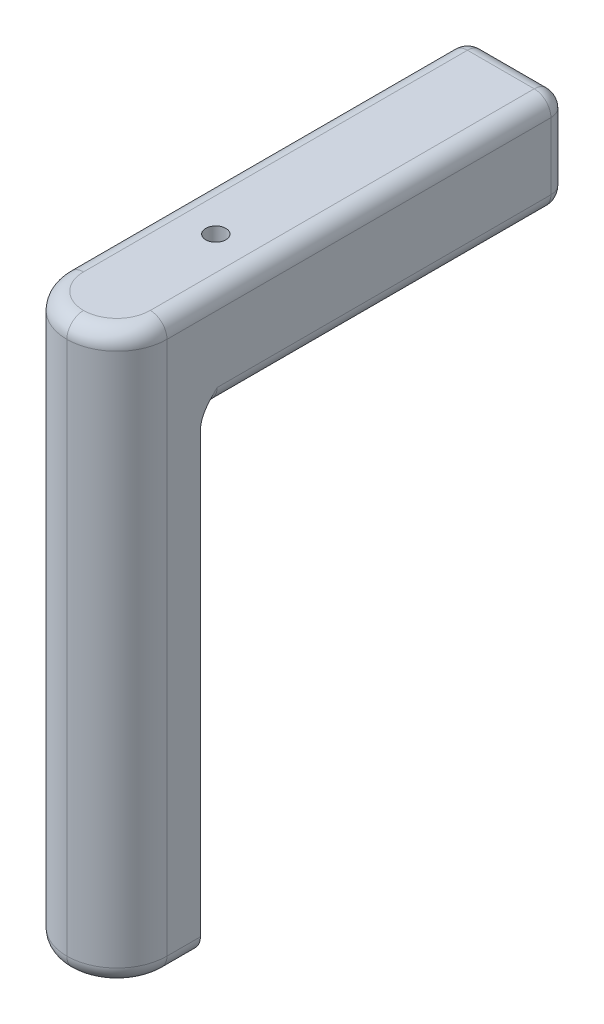
from build123d import *

# Parameters (mm, degrees)
SKETCH1_W           = 60
SKETCH1_H           = 60
BOSS_EXTRUDE1_DEPTH = 270
SKETCH2_W           = 60
SKETCH2_H           = 50
BOSS_EXTRUDE2_DEPTH = 280
SKETCH3_R           = 15
CUT_EXTRUDE1_DEPTH  = 50
SKETCH4_R           = 27.5
CUT_EXTRUDE2_DEPTH  = 25
FILLET1_R           = 30
FILLET2_R           = 30
FILLET3_R           = 10
FILLET4_R           = 10
FILLET5_R           = 10
FILLET6_R           = 10
FILLET7_R           = 10
SKETCH5_R           = 6
CUT_EXTRUDE4_DEPTH  = 394.573373167


# Some blends are built 0.0001 mm under size
with BuildPart() as part:
    # Sketch1 → Boss-Extrude1 (new body)
    with BuildSketch(Plane.XY):
        with Locations((30, -30)):
            Rectangle(SKETCH1_W, SKETCH1_H)
    extrude(amount=BOSS_EXTRUDE1_DEPTH)

    # Sketch2 → Boss-Extrude2 (add)
    with BuildSketch(Plane.XZ.offset(60)):
        with Locations((30, 245)):
            Rectangle(SKETCH2_W, SKETCH2_H)
    extrude(amount=BOSS_EXTRUDE2_DEPTH)

    # Sketch3 → Cut-Extrude1 (cut)
    with BuildSketch(Plane(origin=(0, 0, 0), x_dir=(-1, 0, 0), z_dir=(0, 0, -1))):
        with Locations((-30, -30)):
            Circle(SKETCH3_R)
    extrude(amount=-CUT_EXTRUDE1_DEPTH, mode=Mode.SUBTRACT)

    # Sketch4 → Cut-Extrude2 (cut)
    with BuildSketch(Plane(origin=(0, 0, 220), x_dir=(-1, 0, 0), z_dir=(0, 0, -1))):
        with Locations((-30, -300)):
            Circle(SKETCH4_R)
    extrude(amount=-CUT_EXTRUDE2_DEPTH, mode=Mode.SUBTRACT)

    # Fillet1
    fillet1_edges = [part.edges().sort_by_distance(p)[0] for p in [
        (60, -170, 270),
    ]]
    fillet(fillet1_edges, radius=FILLET1_R)

    # Fillet2
    fillet2_edges = [part.edges().sort_by_distance(p)[0] for p in [
        (0, -170, 270),
    ]]
    fillet(fillet2_edges, radius=FILLET2_R - 0.0001)  # a hair under: the kernel refuses the full size

    # Fillet3
    fillet3_edges = [part.edges().sort_by_distance(p)[0] for p in [
        (60, 0, 120),
        (51.213203436, 0, 261.213203436),
        (0, 0, 120.00005),
        (8.786767275, 0, 261.213232725),
    ]]
    fillet(fillet3_edges, radius=FILLET3_R)

    # Fillet4
    fillet4_edges = [part.edges().sort_by_distance(p)[0] for p in [
        (60, -35, 0),
        (30, 0, 0),
        (0, -35, 0),
        (2.928932188, -2.928932188, 0),
        (57.071067812, -2.928932188, 0),
    ]]
    fillet(fillet4_edges, radius=FILLET4_R)

    # Fillet5
    fillet5_edges = [part.edges().sort_by_distance(p)[0] for p in [
        (60, -60, 115),
        (0, -60, 115),
        (30, -60, 0),
        (2.928932188, -60, 2.928932188),
        (57.071067812, -60, 2.928932188),
    ]]
    fillet(fillet5_edges, radius=FILLET5_R)

    # Fillet6
    # the kernel refuses this fillet: 10 mm, written as the material it adds along each edge
    with BuildSketch(Plane(origin=(50, -60, 220), x_dir=(0, 0, -1), z_dir=(-1, 0, 0))) as fillet6_piece_1:
        with BuildLine():
            CenterArc((FILLET6_R, FILLET6_R), FILLET6_R, 180, 90)
            Line((0, FILLET6_R), (0, 0))
            Line((0, 0), (FILLET6_R, 0))
        make_face()
    extrude(amount=40)
    with BuildSketch(Plane(origin=(50, -50, 220), x_dir=(-0.8017442392976486, 0.5976672776328272, 0), z_dir=(-0.5976672776328272, -0.8017442392976486, 0))) as fillet6_piece_2_section:
        with BuildLine():
            CenterArc((10 + FILLET6_R, FILLET6_R), FILLET6_R, 180, 90)
            Line((10 + FILLET6_R, 0), (10, 0))
            Line((10, 0), (10, FILLET6_R))
        make_face()
    fillet6_piece_2 = revolve(axis=Axis((50, -50, 220), (0, 0, -1)), revolution_arc=233.296989237, mode=Mode.PRIVATE)
    fillet6_piece_2 = split(fillet6_piece_2, bisect_by=Plane(origin=(60, -57.499389328, 216.883716878), z_dir=(-1, 0, 0)), keep=Keep.TOP, mode=Mode.PRIVATE)
    add(fillet6_piece_2)
    with BuildSketch(Plane(origin=(10, -50, 220), x_dir=(0.8017442392976489, 0.5976672776328267, 0), z_dir=(0.5976672776328267, -0.8017442392976489, 0))) as fillet6_piece_3_section:
        with BuildLine():
            CenterArc((10 + FILLET6_R, -FILLET6_R), FILLET6_R, 90, 90)
            Line((10, -FILLET6_R), (10, 0))
            Line((10, 0), (10 + FILLET6_R, 0))
        make_face()
    fillet6_piece_3 = revolve(axis=Axis((10, -50, 220), (0, 0, 1)), revolution_arc=233.296989237, mode=Mode.PRIVATE)
    fillet6_piece_3 = split(fillet6_piece_3, bisect_by=Plane(origin=(0, -57.499389357, 216.883716675), z_dir=(1, 0, 0)), keep=Keep.TOP, mode=Mode.PRIVATE)
    add(fillet6_piece_3)

    # Fillet7
    fillet7_edges = [part.edges().sort_by_distance(p)[0] for p in [
        (60, -340, 230),
        (51.213203436, -340, 261.213203436),
        (0, -340, 230.00005),
        (8.786767275, -340, 261.213232725),
    ]]
    fillet(fillet7_edges, radius=FILLET7_R)

    # Sketch5 → Cut-Extrude4 (cut, through all)
    with BuildSketch(Plane.XZ.offset(60)):
        with Locations((30, 180.76)):
            Circle(SKETCH5_R)
    extrude(amount=-CUT_EXTRUDE4_DEPTH, mode=Mode.SUBTRACT)


solid = part.part
